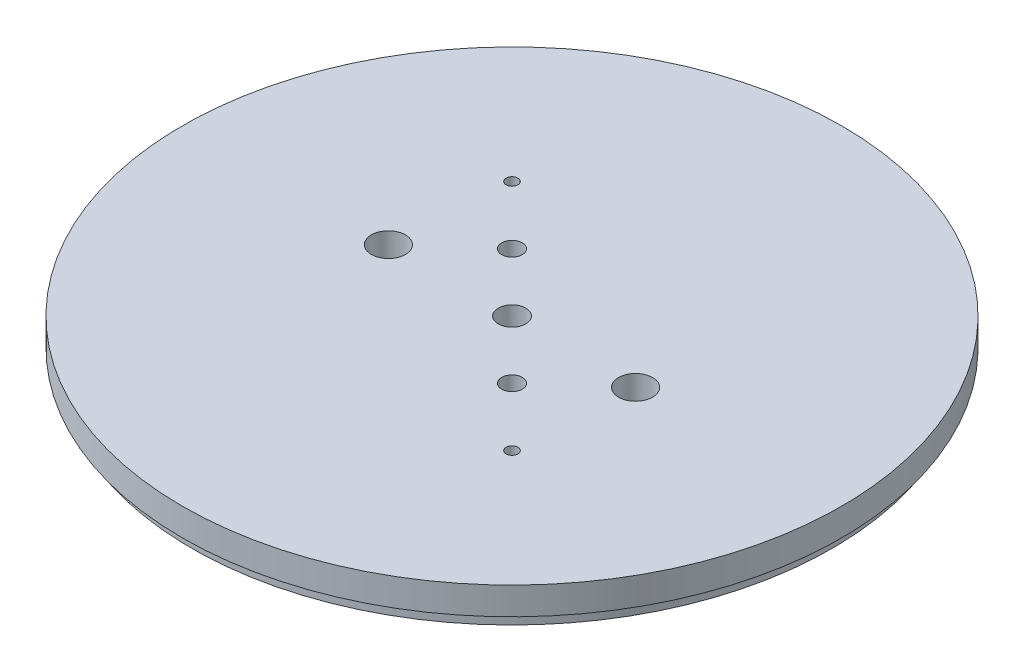
from build123d import *

# Parameters (mm, degrees)
SKETCH1_R           = 76.2
SKETCH1_R_2         = 3.175
SKETCH1_R_3         = 3.937
SKETCH1_R_4         = 1.3589
SKETCH1_R_5         = 2.38125
BOSS_EXTRUDE1_DEPTH = 9.525
SKETCH2_R           = 76.2
SKETCH2_R_2         = 74.041
CUT_EXTRUDE1_DEPTH  = 3.175
CUT_EXTRUDE2_START  = -5.969
CUT_EXTRUDE2_DEPTH  = 3.556


with BuildPart() as part:
    # Sketch1 → Boss-Extrude1 (new body)
    with BuildSketch(Plane(origin=(0, 0, 0), x_dir=(1, 0, 0), z_dir=(0, 1, 0))):
        Circle(SKETCH1_R)
        Circle(SKETCH1_R_2, mode=Mode.SUBTRACT)
        with Locations((28.575, 0)):
            Circle(SKETCH1_R_3, mode=Mode.SUBTRACT)
        with Locations((-28.575, 0)):
            Circle(SKETCH1_R_3, mode=Mode.SUBTRACT)
        with Locations((-26.940768363, 26.940768363)):
            Circle(SKETCH1_R_4, mode=Mode.SUBTRACT)
        with Locations((26.940768363, -26.940768363)):
            Circle(SKETCH1_R_4, mode=Mode.SUBTRACT)
        with Locations((-13.470384182, 13.470384182)):
            Circle(SKETCH1_R_5, mode=Mode.SUBTRACT)
        with Locations((13.470384182, -13.470384182)):
            Circle(SKETCH1_R_5, mode=Mode.SUBTRACT)
    extrude(amount=BOSS_EXTRUDE1_DEPTH)

    # Sketch2 → Cut-Extrude1 (cut)
    with BuildSketch(Plane.XZ):
        Circle(SKETCH2_R)
        Circle(SKETCH2_R_2, mode=Mode.SUBTRACT)
    extrude(amount=-CUT_EXTRUDE1_DEPTH, mode=Mode.SUBTRACT)

    # Sketch3 → Cut-Extrude2 (cut)
    with BuildSketch(Plane(origin=(0, 9.525, 0), x_dir=(1, 0, 0), z_dir=(0, 1, 0)).offset(CUT_EXTRUDE2_START)):
        with BuildLine():
            Line((3.2385, 34.798), (3.2385, 13.97))
            ThreePointArc((3.2385, 13.97), (0, 10.7315), (-3.2385, 13.97))
            Line((-3.2385, 13.97), (-3.2385, 34.798))
            ThreePointArc((-3.2385, 34.798), (0, 38.0365), (3.2385, 34.798))
        make_face()
        with BuildLine():
            Line((3.2385, -34.798), (3.2385, -13.97))
            ThreePointArc((3.2385, -13.97), (0, -10.7315), (-3.2385, -13.97))
            Line((-3.2385, -13.97), (-3.2385, -34.798))
            ThreePointArc((-3.2385, -34.798), (0, -38.0365), (3.2385, -34.798))
        make_face()
    extrude(amount=-CUT_EXTRUDE2_DEPTH, mode=Mode.SUBTRACT)


solid = part.part
